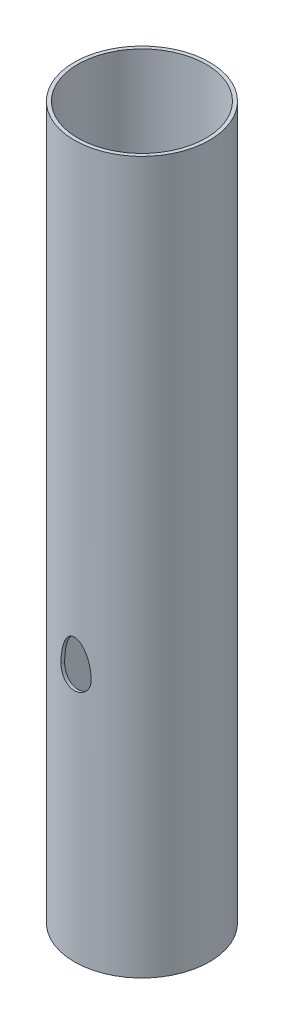
from build123d import *

# Parameters (mm, degrees)
SKETCH2_R           = 38
SKETCH2_R_2         = 36
BOSS_EXTRUDE1_DEPTH = 400
CUT_EXTRUDE1_REACH  = 405.594


with BuildPart() as part:
    # Sketch2 → Boss-Extrude1 (new body)
    with BuildSketch(Plane(origin=(0, 0, 0), x_dir=(1, 0, 0), z_dir=(0, 1, 0))):
        Circle(SKETCH2_R)
        Circle(SKETCH2_R_2, mode=Mode.SUBTRACT)
    extrude(amount=BOSS_EXTRUDE1_DEPTH)

    # Sketch3 → Cut-Extrude1 (cut, up to next)
    with BuildSketch(Plane(origin=(0, 0, 0), x_dir=(-1, 0, 0), z_dir=(0, 0.20449605184179045, 0.978867388761685)), mode=Mode.PRIVATE) as cut_extrude1_sk1:
        with BuildLine():
            ThreePointArc((8.5, -130), (0, -121.5), (-8.5, -130))
            add(Edge.make_bspline(
                [(-8.5, -130), (-8.5, -147), (0, -147), (8.5, -147), (8.5, -130)],
                knots=[4.71238898, 4.71238898, 4.71238898, 6.283185307, 6.283185307, 7.853981634, 7.853981634, 7.853981634], degree=2, weights=[1, 0.707106781, 1, 0.707106781, 1]))
        make_face()
    cut_extrude1_tool1 = extrude(cut_extrude1_sk1.sketch, amount=CUT_EXTRUDE1_REACH, mode=Mode.PRIVATE) & part.part
    add(cut_extrude1_tool1.solids().sort_by_distance((0, 130.782771, -27.321944))[0], mode=Mode.SUBTRACT)


solid = part.part
